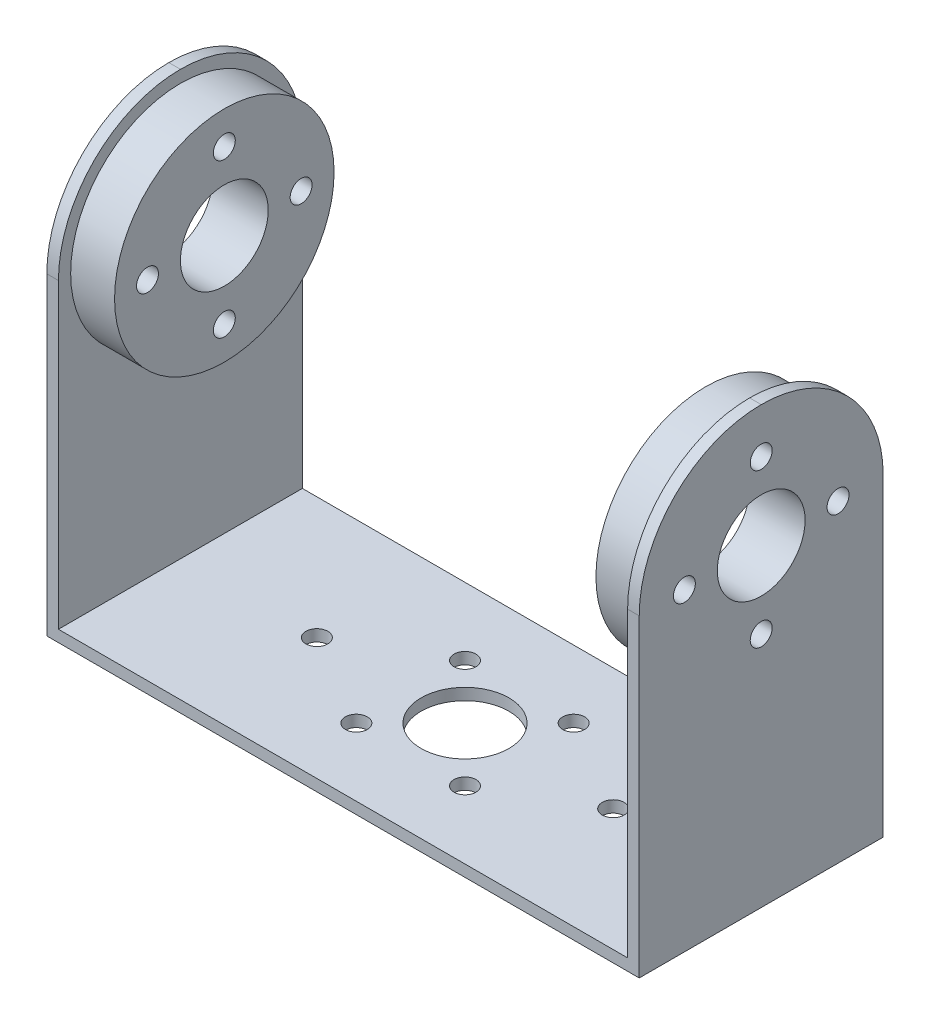
from build123d import *

# Parameters (mm, degrees)
BOSS_EXTRUDE1_DEPTH = 22.225
FILLET1_R           = 11.1125
CUT_EXTRUDE1_REACH  = 72.586
SKETCH4_R           = 4
SKETCH4_R_2         = 1
CIRPATTERN1_COUNT   = 4
SKETCH5_R           = 4
SKETCH5_R_2         = 1
CUT_EXTRUDE2_DEPTH  = 1.058333333
CIRPATTERN2_COUNT   = 4
SKETCH6_R           = 1
CUT_EXTRUDE3_DEPTH  = 1.058333333
BOSS_EXTRUDE2_START = 4
SKETCH7_R           = 10
SKETCH7_R_2         = 1
SKETCH7_R_3         = 4
BOSS_EXTRUDE2_DEPTH = 4


with BuildPart() as part:
    # Sketch2 → Boss-Extrude1 (new body)
    with BuildSketch(Plane.XY):
        Polygon((0, 39.6875), (0, 0), (53.975, 0), (53.975, 39.6875), (52.916666667, 39.6875), (52.916666667, 1.058333333), (1.058333333, 1.058333333), (1.058333333, 39.6875), align=None)
    extrude(amount=BOSS_EXTRUDE1_DEPTH)

    # Fillet1
    fillet1_edges = [part.edges().sort_by_distance(p)[0] for p in [
        (0.529166667, 39.6875, 0),
        (0.529166667, 39.6875, 22.225),
        (53.445833333, 39.6875, 0),
        (53.445833333, 39.6875, 22.225),
    ]]
    fillet(fillet1_edges, radius=FILLET1_R - 0.0001)  # a hair under: the kernel refuses the full size

    # Cut-Extrude1: up to this face of the body (flat: up to its plane)
    cut_extrude1_end = Plane(part.part.faces().sort_by_distance((0, 18.733844913, 11.1125))[0])
    # Sketch4 → Cut-Extrude1 (cut, up to the picked face)
    with BuildSketch(Plane(origin=(53.975, 0, 0), x_dir=(0, 0, -1), z_dir=(1, 0, 0)), mode=Mode.PRIVATE) as cut_extrude1_sk1:
        with Locations((-11.1125, 28.575)):
            Circle(SKETCH4_R)
    cut_extrude1_tool1 = split(extrude(cut_extrude1_sk1.sketch, amount=-CUT_EXTRUDE1_REACH, mode=Mode.PRIVATE), bisect_by=cut_extrude1_end, keep=Keep.BOTH, mode=Mode.PRIVATE)
    # Sketch4 → Cut-Extrude1 (cut, up to the picked face)
    with BuildSketch(Plane(origin=(53.975, 0, 0), x_dir=(0, 0, -1), z_dir=(1, 0, 0)), mode=Mode.PRIVATE) as cut_extrude1_sk2:
        with Locations((-11.1125, 35.575)):
            Circle(SKETCH4_R_2)
    cut_extrude1_tool2 = split(extrude(cut_extrude1_sk2.sketch, amount=-CUT_EXTRUDE1_REACH, mode=Mode.PRIVATE), bisect_by=cut_extrude1_end, keep=Keep.BOTH, mode=Mode.PRIVATE)
    cut_extrude1_1 = cut_extrude1_tool1.solids().sort_by(Axis((53.975, 28.575, 11.1125), (-1, 0, 0)))[0]
    add(cut_extrude1_1, mode=Mode.SUBTRACT)
    cut_extrude1_2 = cut_extrude1_tool2.solids().sort_by(Axis((53.975, 35.575, 11.1125), (-1, 0, 0)))[0]
    add(cut_extrude1_2, mode=Mode.SUBTRACT)
    cut_extrude1 = cut_extrude1_1 + cut_extrude1_2  # Cut-Extrude1 as one shape, for the pattern or mirror that repeats it

    # CirPattern1: Cut-Extrude1 ×4 about axis
    cirpattern1_axis = Axis((0, 28.575, 11.1125), (1, 0, 0))
    for i in range(1, CIRPATTERN1_COUNT):
        add(cut_extrude1.rotate(cirpattern1_axis, i * 360 / CIRPATTERN1_COUNT), mode=Mode.SUBTRACT)

    # Sketch5 → Cut-Extrude2 (cut)
    with BuildSketch(Plane.XZ):
        with Locations(Location((26.9875, 11.1125, 0), (0, 0, 270))):
            Circle(SKETCH5_R)
        with Locations(Location((22.037752532, 6.162752532, 0), (0, 0, 270))):
            Circle(SKETCH5_R_2)
    cut_extrude2 = extrude(amount=-CUT_EXTRUDE2_DEPTH, mode=Mode.SUBTRACT)

    # CirPattern2: Cut-Extrude2 ×4 about axis
    cirpattern2_axis = Axis((26.9875, 0, 11.1125), (0, 1, 0))
    for i in range(1, CIRPATTERN2_COUNT):
        add(cut_extrude2.rotate(cirpattern2_axis, i * 360 / CIRPATTERN2_COUNT), mode=Mode.SUBTRACT)

    # Sketch6 → Cut-Extrude3 (cut)
    with BuildSketch(Plane.XZ):
        with Locations(Location((13.4875, 11.1125, 0), (0, 0, 270))):
            Circle(SKETCH6_R)
        with Locations(Location((40.4875, 11.1125, 0), (0, 0, 270))):
            Circle(SKETCH6_R)
    extrude(amount=-CUT_EXTRUDE3_DEPTH, mode=Mode.SUBTRACT)

    # Sketch7 → Boss-Extrude2 (add)
    with BuildSketch(Plane(origin=(1.058333333, 0, 0), x_dir=(0, 0, -1), z_dir=(1, 0, 0)).offset(BOSS_EXTRUDE2_START)):
        with Locations(Location((-11.1125, 28.575, 0), (0, 0, 180))):
            Circle(SKETCH7_R)
        with Locations((-18.1125, 28.575)):
            Circle(SKETCH7_R_2, mode=Mode.SUBTRACT)
        with Locations((-11.1125, 21.575)):
            Circle(SKETCH7_R_2, mode=Mode.SUBTRACT)
        with Locations((-4.1125, 28.575)):
            Circle(SKETCH7_R_2, mode=Mode.SUBTRACT)
        with Locations((-11.1125, 35.575)):
            Circle(SKETCH7_R_2, mode=Mode.SUBTRACT)
        with Locations((-11.1125, 28.575)):
            Circle(SKETCH7_R_3, mode=Mode.SUBTRACT)
    boss_extrude2 = extrude(amount=-BOSS_EXTRUDE2_DEPTH)

    # Mirror1: Boss-Extrude2 across plane
    add(boss_extrude2.mirror(Plane.ZY.offset(-26.9875)))


solid = part.part
